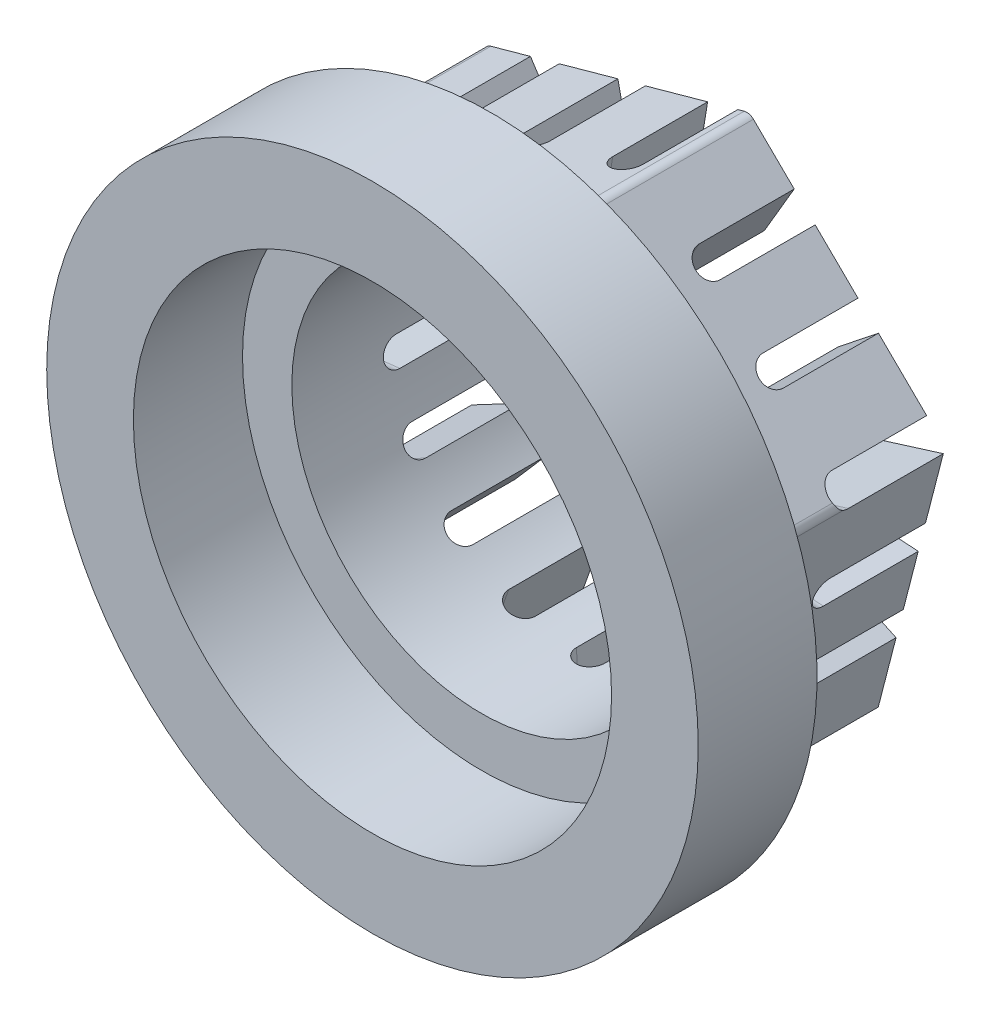
from build123d import *

# Parameters (mm, degrees)
SKETCH1_R           = 21.79955
BOSS_EXTRUDE1_DEPTH = 20.6502
SKETCH2_R           = 12.7
CUT_EXTRUDE1_DEPTH  = 20.6502
SKETCH3_R           = 16.000000004
CUT_EXTRUDE2_DEPTH  = 7.3025
SKETCH4_OUTSIDE_W   = 58.604
SKETCH4_OUTSIDE_H   = 58.604
CUT_EXTRUDE3_DEPTH  = 12.7
CUT_EXTRUDE4_DEPTH  = 9.8552
CIRPATTERN1_COUNT   = 17
FILLET1_R           = 0.635


with BuildPart() as part:
    # Sketch1 → Boss-Extrude1 (new body)
    with BuildSketch(Plane.XY):
        Circle(SKETCH1_R)
    extrude(amount=BOSS_EXTRUDE1_DEPTH)

    # Sketch2 → Cut-Extrude1 (cut)
    with BuildSketch(Plane.XY.offset(20.6502)):
        Circle(SKETCH2_R)
    extrude(amount=-CUT_EXTRUDE1_DEPTH, mode=Mode.SUBTRACT)

    # Sketch3 → Cut-Extrude2 (cut)
    with BuildSketch(Plane.XY.offset(20.6502)):
        Circle(SKETCH3_R)
    extrude(amount=-CUT_EXTRUDE2_DEPTH, mode=Mode.SUBTRACT)

    # Sketch4 outside → Cut-Extrude3 (cut)
    with BuildSketch(Plane(origin=(0, 0, 0), x_dir=(-1, 0, 0), z_dir=(0, 0, -1))):
        Rectangle(SKETCH4_OUTSIDE_W, SKETCH4_OUTSIDE_H)
        Polygon((17.661795398, -4.907322758), (13.080763872, 12.841902112), (-4.581031526, 17.74922487), (-17.661795398, 4.907322758), (-13.080763872, -12.841902112), (4.581031526, -17.74922487), align=None, mode=Mode.SUBTRACT)
    extrude(amount=-CUT_EXTRUDE3_DEPTH, mode=Mode.SUBTRACT)

    # Sketch5 → Cut-Extrude4 (cut, symmetric)
    with BuildSketch(Plane(origin=(-15.371279635, 3.967289677, 0), x_dir=(0, 0, 1), z_dir=(-0.9682695833030739, 0.24990801117629627, 0))):
        with BuildLine():
            Line((6.35, 0.9525), (0, 0.9525))
            Line((0, 0.9525), (0, -0.9525))
            Line((0, -0.9525), (6.35, -0.9525))
            ThreePointArc((6.35, -0.9525), (7.3025, 0), (6.35, 0.9525))
        make_face()
    cut_extrude4 = extrude(amount=CUT_EXTRUDE4_DEPTH, both=True, mode=Mode.SUBTRACT)

    # CirPattern1: Cut-Extrude4 ×17 about axis
    cirpattern1_axis = Axis((0, 0, 13.3477), (0, 0, 1))
    for i in range(1, CIRPATTERN1_COUNT):
        add(cut_extrude4.rotate(cirpattern1_axis, i * 360 / CIRPATTERN1_COUNT), mode=Mode.SUBTRACT)

    # Fillet1
    fillet1_edges = [part.edges().sort_by_distance(p)[0] for p in [
        (-17.661795398, -4.907322758, 6.35),
        (-13.080763872, 12.841902112, 6.35),
        (4.581031526, 17.74922487, 6.35),
        (17.661795398, 4.907322758, 9.908599961),
        (13.080763872, -12.841902112, 9.908599961),
        (-4.581031526, -17.74922487, 6.35),
    ]]
    fillet(fillet1_edges, radius=FILLET1_R)


solid = part.part
